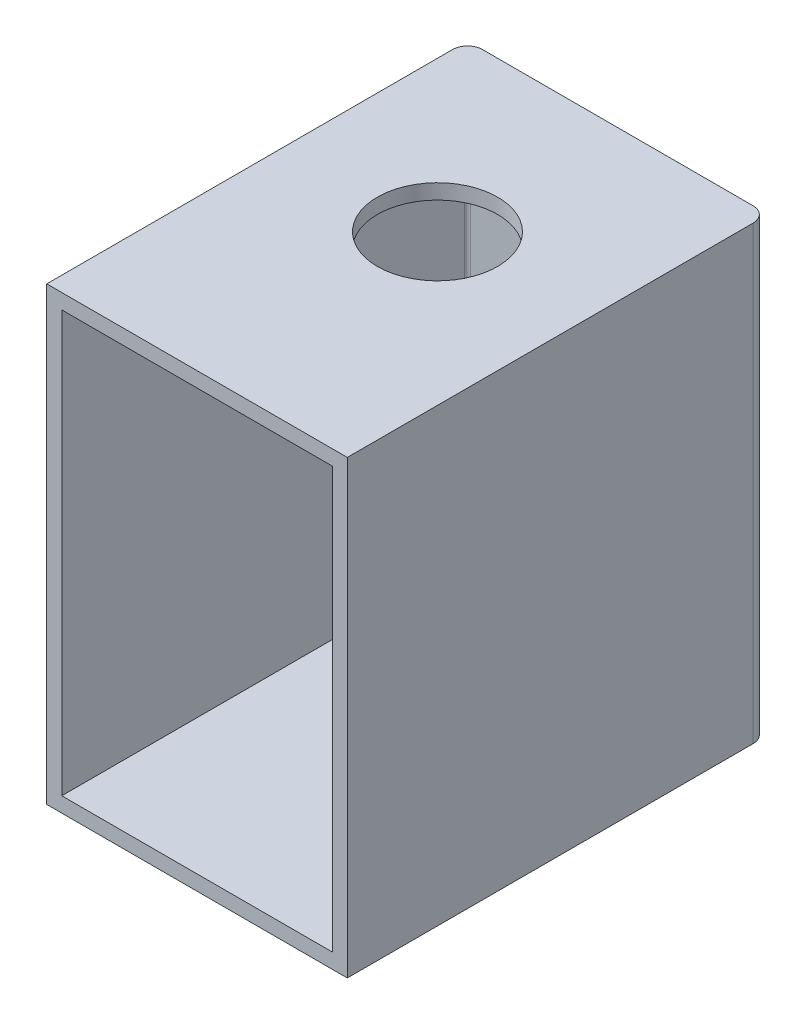
from build123d import *

# Parameters (mm, degrees)
MAINBODYS_W        = 20
MAINBODYS_H        = 28
MAIN_BODY_DEPTH    = 15
MB_FILLET_R        = 1
SHELL_START        = -9
SHELL_MB_OUTLINE_W = 28
SHELL_MB_OUTLINE_H = 27
SHELL_MB_DEPTH     = 18
TOP_BORE_REACH     = 36.583
TOPBORES_R         = 4
BOTTOMBORES_R      = 4.5
BOTTOM_BORE_DEPTH  = 34.7194306
MB_INNER_FILLET_R  = 0.2


# Read off the part's stored shape, not the designer's step: SHELL MB
with BuildPart() as part:
    # MainBodyS → MAIN BODY (new, symmetric)
    with BuildSketch(Plane(origin=(0, 0, 0), x_dir=(1, 0, 0), z_dir=(0, 1, 0))):
        Rectangle(MAINBODYS_W, MAINBODYS_H)
    extrude(amount=MAIN_BODY_DEPTH, both=True)

    # MB FILLET
    mb_fillet_edges = [part.edges().sort_by_distance(p)[0] for p in [
        (-10, 0, -14),
        (10, 0, -14),
    ]]
    fillet(mb_fillet_edges, radius=MB_FILLET_R)

    # SHELL MB outline → SHELL MB (cut)
    with BuildSketch(Plane.YZ.offset(SHELL_START)):
        with Locations((0, 0.5)):
            Rectangle(SHELL_MB_OUTLINE_W, SHELL_MB_OUTLINE_H)
    extrude(amount=SHELL_MB_DEPTH, mode=Mode.SUBTRACT)

    # TopBoreS → TOP BORE (cut, up to next)
    with BuildSketch(Plane(origin=(0, 15, 0), x_dir=(1, 0, 0), z_dir=(0, 1, 0)), mode=Mode.PRIVATE) as top_bore_sk1:
        with Locations(Location((0, 2, 0), (0, 0, 270))):
            Circle(TOPBORES_R)
    top_bore_tool1 = extrude(top_bore_sk1.sketch, amount=-TOP_BORE_REACH, mode=Mode.PRIVATE) & part.part
    add(top_bore_tool1.solids().sort_by_distance((0, 15, -2))[0], mode=Mode.SUBTRACT)

    # BottomBoreS → BOTTOM BORE (cut, through all)
    with BuildSketch(Plane(origin=(0, -14, 0), x_dir=(1, 0, 0), z_dir=(0, 1, 0))):
        with Locations(Location((0, 2, 0), (0, 0, 270))):
            Circle(BOTTOMBORES_R)
    extrude(amount=-BOTTOM_BORE_DEPTH, mode=Mode.SUBTRACT)

    # MB INNER FILLET
    mb_inner_fillet_edges = [part.edges().sort_by_distance(p)[0] for p in [
        (9, 0, -13),
        (-9, 0, -13),
    ]]
    fillet(mb_inner_fillet_edges, radius=MB_INNER_FILLET_R)


solid = part.part
